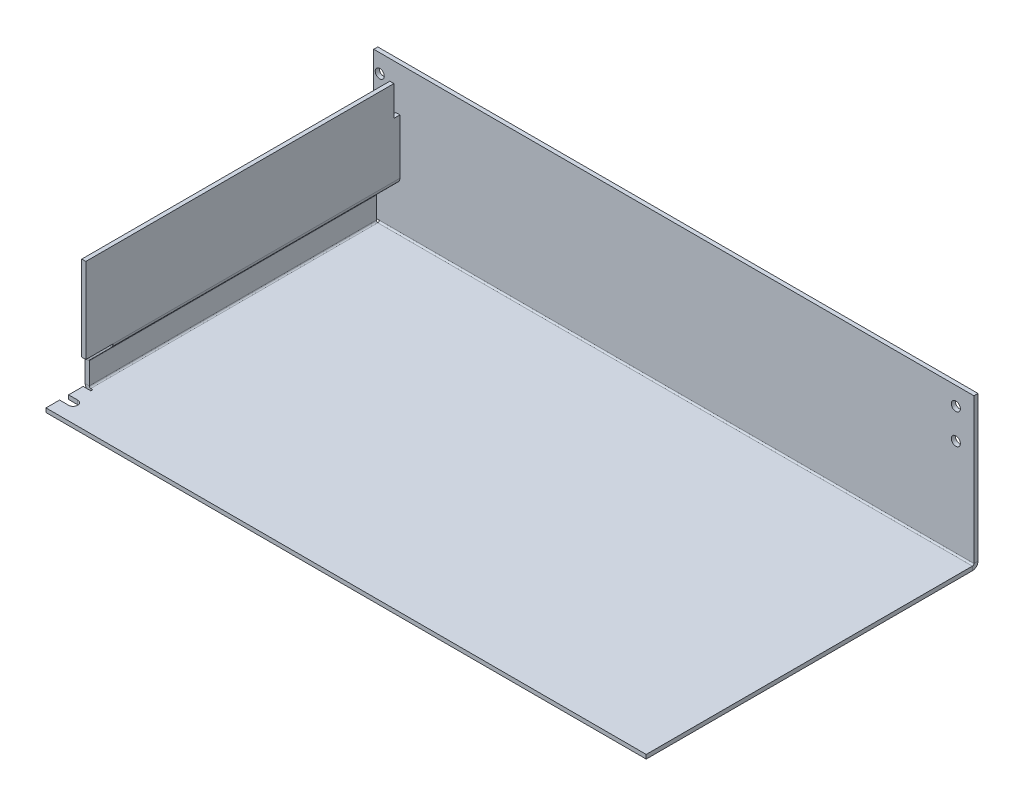
from build123d import *

# Parameters (mm, degrees)
SKETCH1_W                    = 199
SKETCH1_H                    = 110
BASE_FLANGE1_DEPTH           = 1.35
EDGE_FLANGE1_STRIP_W         = 6.4
EDGE_FLANGE1_STRIP_H         = 1.35
EDGE_FLANGE1_STRIP_CUT_DEPTH = 199
EDGE_FLANGE1_DEPTH           = 199
EDGE_FLANGE2_START           = -55
EDGE_FLANGE2_DEPTH           = 97.675
EDGE_FLANGE2_2_DEPTH         = 1.85
EDGE_FLANGE2_START_2         = 42
EDGE_FLANGE2_3_DEPTH         = 0.675
EDGE_FLANGE2_START_3         = -53.15
EDGE_FLANGE2_4_DEPTH         = 95.15
JOG1_START                   = -53.15
JOG1_DEPTH                   = 95.15
JOG1_2_DEPTH                 = 95.15
SKETCH13_W                   = 2
SKETCH13_H                   = 10
CUT_EXTRUDE1_DEPTH           = 10
SKETCH15_R                   = 1.5
CUT_EXTRUDE2_DEPTH           = 10
SKETCH31_W                   = 9
SKETCH31_H                   = 28.176598128
BOSS_EXTRUDE2_DEPTH          = 1.35
CUT_EXTRUDE3_DEPTH           = 124.661119597


# Read off the part's stored shape, not the designer's step: Edge-Flange2, Jog1
# Sheet-metal steps are written as plain solids
with BuildPart() as part:
    # Sketch1 → Base-Flange1 (new body)
    with BuildSketch(Plane(origin=(0, 0, 0), x_dir=(1, 0, 0), z_dir=(0, 1, 0))):
        Rectangle(SKETCH1_W, SKETCH1_H)
    extrude(amount=-BASE_FLANGE1_DEPTH)

    # Edge-Flange1 strip (across the edge) → Edge-Flange1 strip cut (cut)
    with BuildSketch(Plane(origin=(99.5, 0, -55), x_dir=(0, 0, 1), z_dir=(-1, 0, 0))):
        with Locations((-1.35, -0.675)):
            Rectangle(EDGE_FLANGE1_STRIP_W, EDGE_FLANGE1_STRIP_H)
    extrude(amount=EDGE_FLANGE1_STRIP_CUT_DEPTH, mode=Mode.SUBTRACT)

    # Edge-Flange1 section (across the edge) → Edge-Flange1 (add)
    with BuildSketch(Plane(origin=(99.5, 0, -55), x_dir=(0, 0, 1), z_dir=(-1, 0, 0))):
        with BuildLine():
            Line((0, 0.5), (0, 48.65))
            Line((0, 48.65), (1.35, 48.65))
            Line((1.35, 48.65), (1.35, 0.5))
            ThreePointArc((1.35, 0.5), (1.496446609, 0.146446609), (1.85, 0))
            Line((1.85, 0), (1.85, -1.35))
            ThreePointArc((1.85, -1.35), (0.541852455, -0.808147545), (0, 0.5))
        make_face()
    extrude(amount=EDGE_FLANGE1_DEPTH)

    # Edge-Flange2 outline → Edge-Flange2 (cut)
    with BuildSketch(Plane.XY.offset(EDGE_FLANGE2_START)):
        with BuildLine():
            Line((-97.65, 0), (-97.65, 0.5))
            Line((-97.65, 0.5), (-98.15, 0.5))
            ThreePointArc((-98.15, 0.5), (-98.003553391, 0.146446609), (-97.65, 0))
        make_face()
        with BuildLine():
            Line((-99.5, 0.5), (-99.5, -1.35))
            Line((-99.5, -1.35), (-97.65, -1.35))
            ThreePointArc((-97.65, -1.35), (-98.958147545, -0.808147545), (-99.5, 0.5))
        make_face()
    extrude(amount=EDGE_FLANGE2_DEPTH, mode=Mode.SUBTRACT)

    # Edge-Flange2 2 outline → Edge-Flange2 2 (cut)
    with BuildSketch(Plane.XY.offset(EDGE_FLANGE2_START)):
        with BuildLine():
            ThreePointArc((-97.65, 0), (-98.003553391, 0.146446609), (-98.15, 0.5))
            Line((-98.15, 0.5), (-99.5, 0.5))
            ThreePointArc((-99.5, 0.5), (-98.958147545, -0.808147545), (-97.65, -1.35))
            Line((-97.65, -1.35), (-97.65, 0))
        make_face()
    extrude(amount=EDGE_FLANGE2_2_DEPTH, mode=Mode.SUBTRACT)

    # Edge-Flange2 3 outline → Edge-Flange2 3 (cut)
    with BuildSketch(Plane.XY.offset(EDGE_FLANGE2_START_2)):
        with BuildLine():
            Line((-96.975, 0), (-99.431151313, 0))
            ThreePointArc((-99.431151313, 0), (-98.767474832, -0.97436427), (-97.65, -1.35))
            Line((-97.65, -1.35), (-96.975, -1.35))
            Line((-96.975, -1.35), (-96.975, 0))
        make_face()
    extrude(amount=EDGE_FLANGE2_3_DEPTH, mode=Mode.SUBTRACT)

    # Edge-Flange2 4 outline → Edge-Flange2 4 (add)
    with BuildSketch(Plane.XY.offset(EDGE_FLANGE2_START_3)):
        with BuildLine():
            ThreePointArc((-97.65, 0), (-98.003553391, 0.146446609), (-98.15, 0.5))
            Line((-98.15, 0.5), (-98.15, 44.65))
            Line((-98.15, 44.65), (-99.5, 44.65))
            Line((-99.5, 44.65), (-99.5, 0.5))
            ThreePointArc((-99.5, 0.5), (-99.482707004, 0.247641058), (-99.431151313, 0))
            Line((-99.431151313, 0), (-97.65, 0))
        make_face()
    extrude(amount=EDGE_FLANGE2_4_DEPTH)

    # Jog1 outline → Jog1 (cut)
    with BuildSketch(Plane.XY.offset(JOG1_START)):
        with BuildLine():
            Line((-99.5, 44.65), (-99.5, 7.65))
            ThreePointArc((-99.5, 7.65), (-99.359177135, 8.35796435), (-98.958147545, 8.958147545))
            Line((-98.958147545, 8.958147545), (-98.15, 9.76629509))
            Line((-98.15, 9.76629509), (-98.15, 44.65))
            Line((-98.15, 44.65), (-99.5, 44.65))
        make_face()
    extrude(amount=JOG1_DEPTH, mode=Mode.SUBTRACT)

    # Jog1 2 outline → Jog1 2 (add)
    with BuildSketch(Plane.XY.offset(JOG1_START)):
        with BuildLine():
            Line((-91.796446609, 16.119848481), (-98.15, 9.76629509))
            Line((-98.15, 9.76629509), (-98.15, 7.65))
            ThreePointArc((-98.15, 7.65), (-98.111939766, 7.841341716), (-98.003553391, 8.003553391))
            Line((-98.003553391, 8.003553391), (-90.841852455, 15.165254326))
            ThreePointArc((-90.841852455, 15.165254326), (-90.440822865, 15.765437522), (-90.3, 16.473401872))
            Line((-90.3, 16.473401872), (-90.3, 44.65))
            Line((-90.3, 44.65), (-91.65, 44.65))
            Line((-91.65, 44.65), (-91.65, 16.473401872))
            ThreePointArc((-91.65, 16.473401872), (-91.688060234, 16.282060156), (-91.796446609, 16.119848481))
        make_face()
    extrude(amount=JOG1_2_DEPTH)

    # Sketch13 → Cut-Extrude1 (cut)
    with BuildSketch(Plane.ZY.offset(99.5)):
        with Locations((-52.15, 39.65)):
            Rectangle(SKETCH13_W, SKETCH13_H)
    extrude(amount=-CUT_EXTRUDE1_DEPTH, mode=Mode.SUBTRACT)

    # Sketch15 → Cut-Extrude2 (cut)
    with BuildSketch(Plane.XY.offset(-53.65)):
        with Locations((-97.5, 42.65)):
            Circle(SKETCH15_R)
        with Locations((-97.5, 22.65)):
            Circle(SKETCH15_R)
        with Locations((93.5, 42.65)):
            Circle(SKETCH15_R)
        with Locations((93.5, 32.65)):
            Circle(SKETCH15_R)
    extrude(amount=-CUT_EXTRUDE2_DEPTH, mode=Mode.SUBTRACT)

    # Sketch31 → Boss-Extrude2 (add)
    with BuildSketch(Plane.ZY.offset(91.65)):
        with Locations((46.5, 30.561700936)):
            Rectangle(SKETCH31_W, SKETCH31_H)
    extrude(amount=-BOSS_EXTRUDE2_DEPTH)

    # Sketch16 → Cut-Extrude3 (cut, through all)
    with BuildSketch(Plane(origin=(0, 0, 0), x_dir=(1, 0, 0), z_dir=(0, 1, 0))):
        with BuildLine():
            Line((-96.5, -47.5), (-99.5, -47.5))
            Line((-99.5, -47.5), (-99.5, -50.5))
            Line((-99.5, -50.5), (-96.5, -50.5))
            ThreePointArc((-96.5, -50.5), (-95, -49), (-96.5, -47.5))
        make_face()
    extrude(amount=-CUT_EXTRUDE3_DEPTH, mode=Mode.SUBTRACT)


solid = part.part
